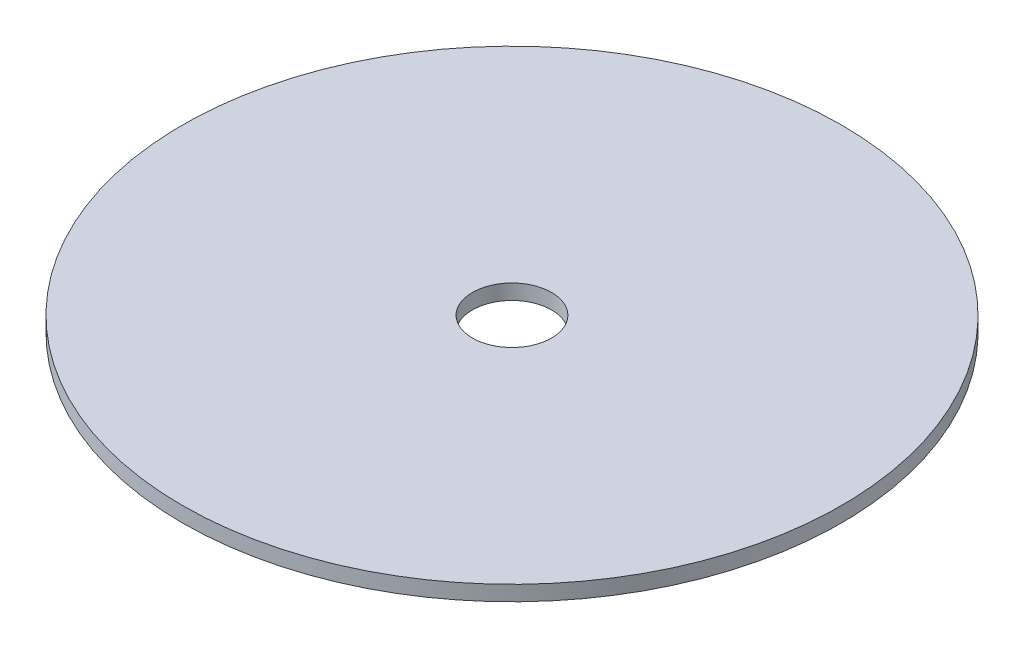
from build123d import *

# Parameters (mm, degrees)
SKETCH1_R          = 50
BASE_FLANGE1_DEPTH = 2.3
SKETCH6_R          = 6
CUT_EXTRUDE1_DEPTH = 10


# Sheet-metal steps are written as plain solids
with BuildPart() as part:
    # Sketch1 → Base-Flange1 (new body)
    with BuildSketch(Plane(origin=(0, 0, 0), x_dir=(1, 0, 0), z_dir=(0, 1, 0))):
        with Locations(Location((0, 0, 0), (0, 0, 270))):
            Circle(SKETCH1_R)
    extrude(amount=-BASE_FLANGE1_DEPTH)

    # Sketch6 → Cut-Extrude1 (cut)
    with BuildSketch(Plane(origin=(0, 0, 0), x_dir=(1, 0, 0), z_dir=(0, 1, 0))):
        with Locations(Location((0, 0, 0), (0, 0, 270))):
            Circle(SKETCH6_R)
    extrude(amount=-CUT_EXTRUDE1_DEPTH, mode=Mode.SUBTRACT)


solid = part.part
